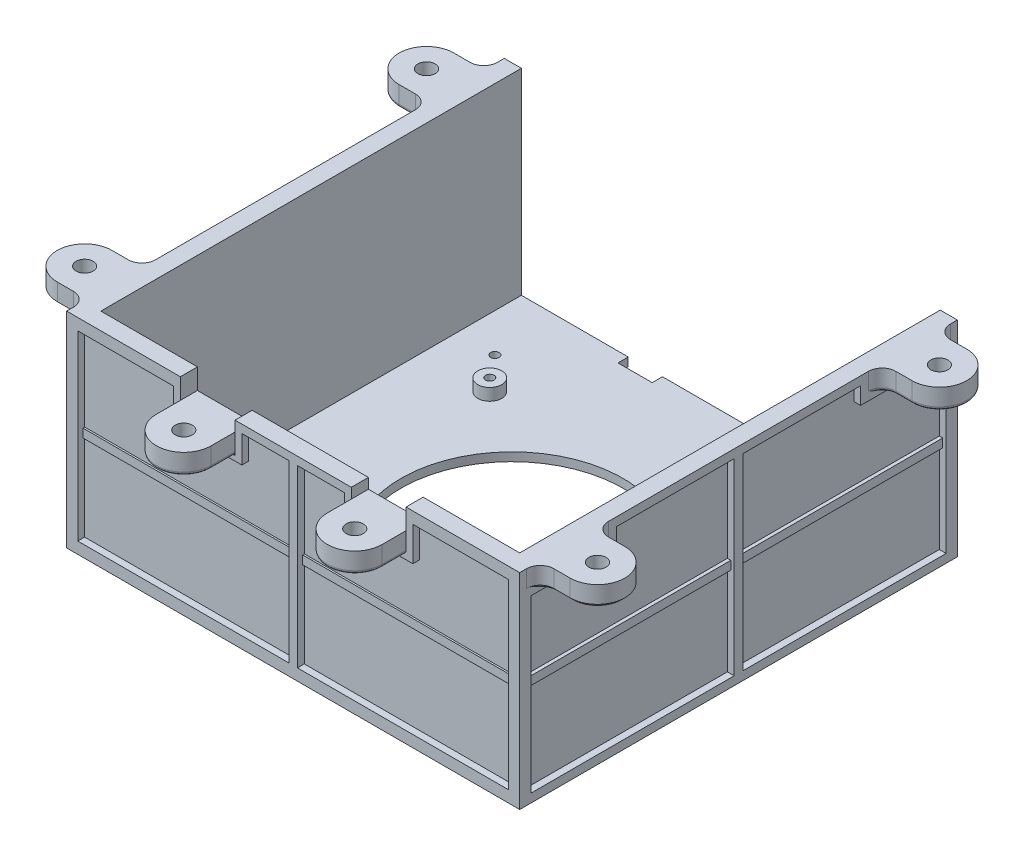
from build123d import *
from build123d.topology import SkipClean

# Parameters (mm, degrees)
SKETCH_1_W                  = 122.5
SKETCH_1_H                  = 128
SKETCH_1_R                  = 32.5
EXTRUDE_2_DEPTH             = 2.5
SKETCH_25_W                 = 5
SKETCH_25_H                 = 60
EXTRUDE_3_DEPTH             = 128
EXTRUDE_4_DEPTH             = 6
HOLE_WIZARD_M6_1_D          = 5
HOLE_WIZARD_M6_1_DEPTH      = 60
FILLET_3435_R               = 4
CHAMFER_5_SIZE              = 1
CUT_EXTRUDE_2_DEPTH         = 2
RIB_START                   = -1.25
RIB_21_OUTLINE_W            = 2
RIB_21_OUTLINE_H            = 55
RIB_21_DEPTH                = 2.5
RIB_19_OUTLINE_W            = 1
RIB_19_OUTLINE_H            = 59.462932812
RIB_19_DEPTH                = 2.5
MIRROR_START                = -1.25
MIRROR_24_COPY_1_SKETCH_W   = 1
MIRROR_24_COPY_1_SKETCH_H   = 59.462932812
MIRROR_24_COPY_1_DEPTH      = 2.5
SKETCH_75_R                 = 3.5
ADAPTER1_DEPTH              = 6
SKETCH_106_W                = 1.25
SKETCH_106_H                = 2.5
HOLE_WIZARD_M3_1_AT_2_COUNT = 2
HOLE_WIZARD_M3_1_AT_2_PITCH = 13.124404748
HOLE_WIZARD_M3_2_D          = 2.5
MIRROR_26_COPY_1_SKETCH_W   = 1.25
MIRROR_26_COPY_1_SKETCH_H   = 2.5
MIRROR_26_COPY_2_D          = 2.5
MIRROR_26_COPY_3_D          = 2.5
FILLET_7_R                  = 4
MIRROR_30_COPY_1_D          = 5
MIRROR_30_COPY_1_DEPTH      = 60
MIRROR_30_COPY_2_D          = 5
MIRROR_30_COPY_2_DEPTH      = 60
SKETCH_112_W                = 122.5
SKETCH_112_H                = 5
EXTRUDE_5_DEPTH             = 57.5
CUT_EXTRUDE_6_DEPTH         = 2
RIB_30_OUTLINE_W            = 2
RIB_30_OUTLINE_H            = 51.25
RIB_30_DEPTH                = 2.5
RIB_35_OUTLINE_W            = 61.75
RIB_35_OUTLINE_H            = 0.5
RIB_35_DEPTH                = 2.5
SKETCH_131_W                = 16
SKETCH_131_H                = 5
CUT_EXTRUDE_7_DEPTH         = 182.946592439
EXTRUDE_8_DEPTH             = 6
SKETCH_134_W                = 2.5
SKETCH_134_H                = 54
MIRROR_START_2              = 54
MIRROR_40_OUTLINE_W         = 16
MIRROR_40_OUTLINE_H         = 5
MIRROR_40_DEPTH             = 6
MIRROR_START_3              = 48
MIRROR_40_2_OUTLINE_R       = 2.5
MIRROR_40_2_DEPTH           = 6
FILLET_10_R                 = 1
FILLET_11_R                 = 1
EXTRUDE_9_DEPTH             = 3
SKETCH_138_W                = 1.65
SKETCH_138_H                = 140
FILLET_13_R                 = 1
SKETCH_139_W                = 10
SKETCH_139_H                = 2.5
CUT_EXTRUDE_8_DEPTH         = 3
SKETCH_140_W                = 34
SKETCH_140_H                = 5
CUT_EXTRUDE_9_DEPTH         = 3
FILLET_15_R                 = 1
MIRROR_START_4              = -1
MIRROR_48_OUTLINE_R         = 1.25
MIRROR_48_DEPTH             = 4
MIRROR_49_OUTLINE_R         = 1.25
MIRROR_49_DEPTH             = 4


with BuildPart() as part:
    # 草图1 → 凸台-拉伸2 (new body)
    with BuildSketch(Plane(origin=(0, 0, 0), x_dir=(1, 0, 0), z_dir=(0, 1, 0))):
        with Locations((53.75, 46)):
            Rectangle(SKETCH_1_W, SKETCH_1_H)
        with Locations(Location((53.75, 46, 0), (0, 0, 270))):
            Circle(SKETCH_1_R, mode=Mode.SUBTRACT)
    extrude(amount=EXTRUDE_2_DEPTH)

    # 草图25 → 凸台-拉伸3 (add)
    with BuildSketch(Plane.XY.offset(18)):
        with Locations((-10, 30)):
            Rectangle(SKETCH_25_W, SKETCH_25_H)
        with Locations((117.5, 30)):
            Rectangle(SKETCH_25_W, SKETCH_25_H)
    extrude(amount=-EXTRUDE_3_DEPTH)

    # 草图67 → 凸台-拉伸4 (add)
    with BuildSketch(Plane(origin=(0, 60, 0), x_dir=(1, 0, 0), z_dir=(0, 1, 0))):
        with BuildLine():
            Line((120, -12), (128.75, -12))
            ThreePointArc((128.75, -12), (136.75, -4), (128.75, 4))
            Line((128.75, 4), (120, 4))
            Line((120, 4), (120, -12))
        make_face()
        with BuildLine():
            Line((120, 104), (120, 88))
            Line((120, 88), (128.75, 88))
            ThreePointArc((128.75, 88), (136.75, 96), (128.75, 104))
            Line((128.75, 104), (120, 104))
        make_face()
    extrude_4 = extrude(amount=-EXTRUDE_4_DEPTH)

    # M6 螺纹孔1
    with Locations(Plane(origin=(0, 60, 0), x_dir=(1, 0, 0), z_dir=(0, 1, 0))):
        with Locations((128.75, -4)):
            hole_wizard_m6_1 = Hole(HOLE_WIZARD_M6_1_D / 2, depth=HOLE_WIZARD_M6_1_DEPTH)

    # 镜向15: 凸台-拉伸4, M6 螺纹孔1 across plane
    add(extrude_4.mirror(Plane.ZY.offset(-53.75)))
    add(hole_wizard_m6_1.mirror(Plane.ZY.offset(-53.75)), mode=Mode.SUBTRACT)

    # Fillet 3435
    fillet_3435_edges = [part.edges().sort_by_distance(p)[0] for p in [
        (120, 57, 12),
        (120, 57, -4),
        (-12.5, 57, -4),
        (-12.5, 57, 12),
    ]]
    fillet(fillet_3435_edges, radius=FILLET_3435_R)

    # Chamfer 5
    # the kernel refuses this chamfer: 1 mm, written as the material it takes off along each edge
    with BuildSketch(Plane(origin=(-16.5, 54, 12), x_dir=(0, 1, 0), z_dir=(-1, 0, 0)), Plane(origin=(-21.25, 54, -4), x_dir=(0, 1, 0), z_dir=(1, 0, 0))) as chamfer_5_piece_1:
        Polygon((CHAMFER_5_SIZE, 0), (0, CHAMFER_5_SIZE), (0, 0), align=None)
    extrude(amount=4.75, mode=Mode.SUBTRACT)
    with BuildSketch(Plane(origin=(124, 54, 12), x_dir=(0, 1, 0), z_dir=(1, 0, 0)), Plane(origin=(128.75, 54, -4), x_dir=(0, 1, 0), z_dir=(-1, 0, 0))) as chamfer_5_piece_2:
        Polygon((CHAMFER_5_SIZE, 0), (0, -CHAMFER_5_SIZE), (0, 0), align=None)
    extrude(amount=4.75, mode=Mode.SUBTRACT)
    with BuildSketch(Plane(origin=(-16.5, 54, -8), x_dir=(0.4594643283899522, 0, -0.8881962232171281), z_dir=(-0.8881962232171281, 0, -0.4594643283899522))) as chamfer_5_piece_3_section:
        Polygon((4, -CHAMFER_5_SIZE), (4 + CHAMFER_5_SIZE, 0), (4, 0), align=None)
    chamfer_5_piece_3 = revolve(axis=Axis((-16.5, 54, -8), (0, -1, 0)), revolution_arc=152.647453006, mode=Mode.PRIVATE)
    chamfer_5_piece_3 = split(chamfer_5_piece_3, bisect_by=Plane(origin=(-12.5, 54, -8), z_dir=(-1, 0, 0)), keep=Keep.TOP, mode=Mode.PRIVATE)
    add(chamfer_5_piece_3, mode=Mode.SUBTRACT)
    with BuildSketch(Plane(origin=(-16.5, 54, 16), x_dir=(0.45946432838995255, 0, 0.8881962232171279), z_dir=(-0.8881962232171279, 0, 0.45946432838995255))) as chamfer_5_piece_4_section:
        Polygon((4 + CHAMFER_5_SIZE, 0), (4, CHAMFER_5_SIZE), (4, 0), align=None)
    chamfer_5_piece_4 = revolve(axis=Axis((-16.5, 54, 16), (0, 1, 0)), revolution_arc=152.647453006, mode=Mode.PRIVATE)
    chamfer_5_piece_4 = split(chamfer_5_piece_4, bisect_by=Plane(origin=(-12.5, 54, 16), z_dir=(-1, 0, 0)), keep=Keep.TOP, mode=Mode.PRIVATE)
    add(chamfer_5_piece_4, mode=Mode.SUBTRACT)
    with BuildSketch(Plane(origin=(124, 54, 16), x_dir=(-0.4594643283899522, 0, 0.8881962232171281), z_dir=(0.8881962232171281, 0, 0.4594643283899522))) as chamfer_5_piece_5_section:
        Polygon((4, -CHAMFER_5_SIZE), (4 + CHAMFER_5_SIZE, 0), (4, 0), align=None)
    chamfer_5_piece_5 = revolve(axis=Axis((124, 54, 16), (0, -1, 0)), revolution_arc=152.647453006, mode=Mode.PRIVATE)
    chamfer_5_piece_5 = split(chamfer_5_piece_5, bisect_by=Plane(origin=(120, 54, 16), z_dir=(1, 0, 0)), keep=Keep.TOP, mode=Mode.PRIVATE)
    add(chamfer_5_piece_5, mode=Mode.SUBTRACT)
    with BuildSketch(Plane(origin=(124, 54, -8), x_dir=(-0.4594643283899523, 0, -0.8881962232171279), z_dir=(0.8881962232171279, 0, -0.4594643283899523))) as chamfer_5_piece_6_section:
        Polygon((4 + CHAMFER_5_SIZE, 0), (4, CHAMFER_5_SIZE), (4, 0), align=None)
    chamfer_5_piece_6 = revolve(axis=Axis((124, 54, -8), (0, 1, 0)), revolution_arc=152.647453006, mode=Mode.PRIVATE)
    chamfer_5_piece_6 = split(chamfer_5_piece_6, bisect_by=Plane(origin=(120, 54, -8), z_dir=(1, 0, 0)), keep=Keep.TOP, mode=Mode.PRIVATE)
    add(chamfer_5_piece_6, mode=Mode.SUBTRACT)
    with BuildSketch(Plane(origin=(128.75, 54, 4), x_dir=(0, 0, 1), z_dir=(-1, 0, 0))) as chamfer_5_piece_7:
        Polygon((8, CHAMFER_5_SIZE), (8 - CHAMFER_5_SIZE, 0), (8, 0), align=None)
    revolve(axis=Axis((128.75, 54, 4), (0, 1, 0)), revolution_arc=180, mode=Mode.SUBTRACT)
    with BuildSketch(Plane(origin=(-21.25, 54, 4), x_dir=(0, 0, 1), z_dir=(1, 0, 0))) as chamfer_5_piece_8:
        Polygon((8, -CHAMFER_5_SIZE), (8 - CHAMFER_5_SIZE, 0), (8, 0), align=None)
    revolve(axis=Axis((-21.25, 54, 4), (0, -1, 0)), revolution_arc=180, mode=Mode.SUBTRACT)

    # 草图79 → 切除-拉伸2 (cut)
    with BuildSketch(Plane(origin=(120, 0, 0), x_dir=(0, 0, -1), z_dir=(1, 0, 0))):
        Polygon((106.712932812, 2.5), (-14.712932812, 2.5), (-14.712932812, 52.5), (10.287067188, 52.5), (10.287067188, 57.5), (81.712932812, 57.5), (81.712932812, 52.5), (106.712932812, 52.5), align=None)
    cut_extrude_2 = extrude(amount=-CUT_EXTRUDE_2_DEPTH, mode=Mode.SUBTRACT)

    # 筋21: read off the stored shape, not the designer's step
    # 筋21 outline → 筋21 (add)
    with BuildSketch(Plane.XY.offset(-46).offset(RIB_START)):
        with Locations((119, 30)):
            Rectangle(RIB_21_OUTLINE_W, RIB_21_OUTLINE_H)
    rib_21 = extrude(amount=RIB_21_DEPTH)

    # 筋19: read off the stored shape, not the designer's step
    # 筋19 outline → 筋19 (add)
    with BuildSketch(Plane(origin=(0, 30, 0), x_dir=(1, 0, 0), z_dir=(0, 1, 0)).offset(RIB_START)):
        with Locations((118.5, 15.018533594)):
            Rectangle(RIB_19_OUTLINE_W, RIB_19_OUTLINE_H)
    rib_19 = extrude(amount=RIB_19_DEPTH)

    # 镜向23: 筋19 across plane
    add(rib_19.mirror(Plane.XY.offset(-46)))

    # 镜向24: 切除-拉伸2, 筋21, 筋19 across plane
    add(cut_extrude_2.mirror(Plane.ZY.offset(-53.75)), mode=Mode.SUBTRACT)
    add(rib_21.mirror(Plane.ZY.offset(-53.75)))
    add(rib_19.mirror(Plane.ZY.offset(-53.75)))

    # 镜向24 copy 1 sketch → 镜向24 copy 1 (add)
    with BuildSketch(Plane(origin=(107.5, 30, -92), x_dir=(-1, 0, 0), z_dir=(0, 1, 0)).offset(MIRROR_START)):
        with Locations((118.5, 15.018533594)):
            Rectangle(MIRROR_24_COPY_1_SKETCH_W, MIRROR_24_COPY_1_SKETCH_H)
    extrude(amount=MIRROR_24_COPY_1_DEPTH)

    # 草图75 → 定位adapter1 (add)
    with BuildSketch(Plane(origin=(0, 0, 0), x_dir=(-1, 0, 0), z_dir=(0, -1, 0))):
        with Locations(Location((-12.25, 81, 0), (0, 0, 90))):
            Circle(SKETCH_75_R)
        with Locations(Location((-95.25, 81, 0), (0, 0, 90))):
            Circle(SKETCH_75_R)
        with Locations(Location((-95.25, 11, 0), (0, 0, 90))):
            Circle(SKETCH_75_R)
        with Locations(Location((-12.25, 11, 0), (0, 0, 90))):
            Circle(SKETCH_75_R)
    extrude(amount=-ADAPTER1_DEPTH)

    # 草图106 → M3 螺纹孔1 (revolve, cut)
    with BuildSketch(Plane(origin=(12.25, 2.5, -81), x_dir=(0, 0, 1), z_dir=(1, 0, 0))):
        with Locations((0.625, 1.25)):
            Rectangle(SKETCH_106_W, SKETCH_106_H)
    hole_wizard_m3_1 = revolve(axis=Axis((12.25, 8.85, -81), (0, -1, 0)), mode=Mode.SUBTRACT)

    # M3 螺纹孔1 at 2: M3 螺纹孔1 ×2
    with Locations(*[Vector(-0.6476484200955406, 0, -0.7619393177594592) * (i * HOLE_WIZARD_M3_1_AT_2_PITCH) for i in range(1, HOLE_WIZARD_M3_1_AT_2_COUNT)]):
        add(hole_wizard_m3_1, mode=Mode.SUBTRACT)

    # M3 螺纹孔2 (through all)
    with Locations(Plane(origin=(0, 6, 0), x_dir=(1, 0, 0), z_dir=(0, 1, 0))):
        with Locations((12.25, 81)):
            hole_wizard_m3_2 = Hole(HOLE_WIZARD_M3_2_D / 2)

    # 镜向25: M3 螺纹孔2 across plane
    with SkipClean():  # the faces are left unmerged after this step: merging them gives an invalid solid
        add(hole_wizard_m3_2.mirror(Plane.ZY.offset(-53.75)), mode=Mode.SUBTRACT)

    # 镜向26: M3 螺纹孔1 across plane
    with SkipClean():  # the faces are left unmerged after this step: merging them gives an invalid solid
        add(hole_wizard_m3_1.mirror(Plane.XY.offset(-46)), mode=Mode.SUBTRACT)

    # 镜向26 copy 1 sketch → 镜向26 copy 1 (revolve, cut)
    with SkipClean():  # the faces are left unmerged after this step: merging them gives an invalid solid
        with BuildSketch(Plane(origin=(3.75, 2.5, -1), x_dir=(0, 0, -1), z_dir=(1, 0, 0))):
            with Locations((0.625, -1.25)):
                Rectangle(MIRROR_26_COPY_1_SKETCH_W, MIRROR_26_COPY_1_SKETCH_H)
        revolve(axis=Axis((3.75, 8.85, -1), (0, 1, 0)), mode=Mode.SUBTRACT)

    # 镜向26 copy 2 (through all)
    with Locations(Plane(origin=(107.5, 6, -92), x_dir=(-1, 0, 0), z_dir=(0, 1, 0))):
        with Locations((12.25, 81)):
            Hole(MIRROR_26_COPY_2_D / 2)

    # 镜向26 copy 3 (through all)
    with Locations(Plane(origin=(0, 6, -92), x_dir=(1, 0, 0), z_dir=(0, 1, 0))):
        with Locations((12.25, -81)):
            Hole(MIRROR_26_COPY_3_D / 2)

    # 镜向27: M6 螺纹孔1 across plane
    with SkipClean():  # the faces are left unmerged after this step: merging them gives an invalid solid
        add(hole_wizard_m6_1.mirror(Plane.XY.offset(-46)), mode=Mode.SUBTRACT)

    # 圆角7
    fillet_7_edges = [part.edges().sort_by_distance(p)[0] for p in [
        (120, 57, -104),
        (120, 57, -88),
        (-12.5, 57, -104),
        (-12.5, 57, -88),
    ]]
    fillet(fillet_7_edges, radius=FILLET_7_R)

    # 镜向30 copy 1
    with Locations(Plane(origin=(107.5, 60, -92), x_dir=(-1, 0, 0), z_dir=(0, 1, 0))):
        with Locations((128.75, -4)):
            Hole(MIRROR_30_COPY_1_D / 2, depth=MIRROR_30_COPY_1_DEPTH)

    # 镜向30 copy 2
    with Locations(Plane(origin=(107.5, 60, 0), x_dir=(-1, 0, 0), z_dir=(0, 1, 0))):
        with Locations((128.75, 4)):
            Hole(MIRROR_30_COPY_2_D / 2, depth=MIRROR_30_COPY_2_DEPTH)

    # 草图112 → 凸台-拉伸5 (add)
    with SkipClean():  # the faces are left unmerged after this step: merging them gives an invalid solid
        with BuildSketch(Plane(origin=(0, 2.5, 0), x_dir=(1, 0, 0), z_dir=(0, 1, 0))):
            with Locations((53.75, -15.5)):
                Rectangle(SKETCH_112_W, SKETCH_112_H)
        extrude(amount=EXTRUDE_5_DEPTH)

    # 草图124 → 切除-拉伸6 (cut)
    with SkipClean():  # the faces are left unmerged after this step: merging them gives an invalid solid
        with BuildSketch(Plane.XY.offset(18)):
            Polygon((116.75, 56.625), (88.75, 56.625), (88.75, 46.625), (68.75, 46.625), (68.75, 54.625), (38.75, 54.625), (38.75, 46.625), (18.75, 46.625), (18.75, 56.625), (-9.25, 56.625), (-9.25, 3.375), (116.75, 3.375), align=None)
        extrude(amount=-CUT_EXTRUDE_6_DEPTH, mode=Mode.SUBTRACT)

    # 筋30: read off the stored shape, not the designer's step
    # 筋30 outline → 筋30 (add)
    with SkipClean():  # the faces are left unmerged after this step: merging them gives an invalid solid
        with BuildSketch(Plane.ZY.offset(-53.75).offset(RIB_START)):
            with Locations((17, 29)):
                Rectangle(RIB_30_OUTLINE_W, RIB_30_OUTLINE_H)
        extrude(amount=RIB_30_DEPTH)

    # 筋35: read off the stored shape, not the designer's step
    # 筋35 outline → 筋35 (add)
    with SkipClean():  # the faces are left unmerged after this step: merging them gives an invalid solid
        with BuildSketch(Plane(origin=(0, 30, 0), x_dir=(1, 0, 0), z_dir=(0, 1, 0)).offset(RIB_START)):
            with Locations((21.625, -16.25)):
                Rectangle(RIB_35_OUTLINE_W, RIB_35_OUTLINE_H)
        rib_35 = extrude(amount=RIB_35_DEPTH)

    # 镜向35: 筋35 across plane
    with SkipClean():  # the faces are left unmerged after this step: merging them gives an invalid solid
        add(rib_35.mirror(Plane.ZY.offset(-53.75)))

    # 草图131 → 切除-拉伸7 (cut, through all)
    with SkipClean():  # the faces are left unmerged after this step: merging them gives an invalid solid
        with BuildSketch(Plane(origin=(0, 48, 0), x_dir=(1, 0, 0), z_dir=(0, 1, 0))):
            with Locations((28.75, -15.5)):
                Rectangle(SKETCH_131_W, SKETCH_131_H)
        extrude(amount=CUT_EXTRUDE_7_DEPTH, mode=Mode.SUBTRACT)

    # 镜向40: read off the stored shape, not the designer's step
    # 镜向40 outline → 镜向40 (cut)
    with SkipClean():  # the faces are left unmerged after this step: merging them gives an invalid solid
        with BuildSketch(Plane(origin=(0, 0, 0), x_dir=(1, 0, 0), z_dir=(0, 1, 0)).offset(MIRROR_START_2)):
            with Locations((78.75, -15.5)):
                Rectangle(MIRROR_40_OUTLINE_W, MIRROR_40_OUTLINE_H)
        extrude(amount=MIRROR_40_DEPTH, mode=Mode.SUBTRACT)

    # Mirror 40 2 outline → Mirror 40 2 (add)
    with SkipClean():  # the faces are left unmerged after this step: merging them gives an invalid solid
        with BuildSketch(Plane(origin=(0, 0, 0), x_dir=(1, 0, 0), z_dir=(0, 1, 0)).offset(MIRROR_START_3)):
            with BuildLine():
                Line((86.75, -25), (86.75, -18))
                Line((86.75, -18), (70.75, -18))
                Line((70.75, -18), (70.75, -25))
                ThreePointArc((70.75, -25), (78.75, -33), (86.75, -25))
            make_face()
            with Locations((78.75, -25)):
                Circle(MIRROR_40_2_OUTLINE_R, mode=Mode.SUBTRACT)
        extrude(amount=MIRROR_40_2_DEPTH)

    # 圆角11
    fillet_11_edges = [part.edges().sort_by_distance(p)[0] for p in [
        (70.75, 48, 21.5),
        (86.75, 48, 21.5),
        (78.75, 48, 33),
    ]]
    fillet(fillet_11_edges, radius=FILLET_11_R)

    # 草图135 → 凸台-拉伸9 (add)
    with SkipClean():  # the faces are left unmerged after this step: merging them gives an invalid solid
        with BuildSketch(Plane(origin=(0, 0, -104), x_dir=(-1, 0, 0), z_dir=(0, 0, -1))):
            with BuildLine():
                Line((-83.75, 2.5), (-73.75, 2.5))
                Line((-73.75, 2.5), (-73.75, -5.5))
                ThreePointArc((-73.75, -5.5), (-78.75, -10.5), (-83.75, -5.5))
                Line((-83.75, -5.5), (-83.75, 2.5))
            make_face()
            with BuildLine():
                Line((-33.75, 2.5), (-33.75, -5.5))
                ThreePointArc((-33.75, -5.5), (-28.75, -10.5), (-23.75, -5.5))
                Line((-23.75, -5.5), (-23.75, 2.5))
                Line((-23.75, 2.5), (-33.75, 2.5))
            make_face()
        extrude(amount=EXTRUDE_9_DEPTH)

    # 草图138 → M4 螺纹孔11 (revolve, cut)
    with SkipClean():  # the faces are left unmerged after this step: merging them gives an invalid solid
        with BuildSketch(Plane(origin=(78.75, -5.5, -107), x_dir=(0, 1, 0), z_dir=(1, 0, 0))):
            with Locations((0.825, 70)):
                Rectangle(SKETCH_138_W, SKETCH_138_H)
        hole_wizard_m4_11 = revolve(axis=Axis((78.75, -5.5, -113.35), (0, 0, 1)), mode=Mode.SUBTRACT)

    # 镜向46: M4 螺纹孔11 across plane
    with SkipClean():  # the faces are left unmerged after this step: merging them gives an invalid solid
        add(hole_wizard_m4_11.mirror(Plane.ZY.offset(-53.75)), mode=Mode.SUBTRACT)

    # 圆角13
    fillet_13_edges = [part.edges().sort_by_distance(p)[0] for p in [
        (83.75, -2.75, -104),
        (78.75, -10.5, -104),
        (73.75, -2.75, -104),
        (33.75, -2.75, -104),
        (28.75, -10.5, -104),
        (23.75, -2.75, -104),
    ]]
    fillet(fillet_13_edges, radius=FILLET_13_R)

    # 草图139 → 切除-拉伸8 (cut)
    with SkipClean():  # the faces are left unmerged after this step: merging them gives an invalid solid
        with BuildSketch(Plane(origin=(0, 0, -110), x_dir=(-1, 0, 0), z_dir=(0, 0, -1))):
            with Locations((-78.75, 1.25)):
                Rectangle(SKETCH_139_W, SKETCH_139_H)
        cut_extrude_8 = extrude(amount=-CUT_EXTRUDE_8_DEPTH, mode=Mode.SUBTRACT)

    # 镜向47: 切除-拉伸8 across plane
    with SkipClean():  # the faces are left unmerged after this step: merging them gives an invalid solid
        add(cut_extrude_8.mirror(Plane.ZY.offset(-53.75)), mode=Mode.SUBTRACT)

    # 草图140 → 切除-拉伸9 (cut)
    with SkipClean():  # the faces are left unmerged after this step: merging them gives an invalid solid
        with BuildSketch(Plane(origin=(0, 60, 0), x_dir=(1, 0, 0), z_dir=(0, 1, 0))):
            with Locations((53.75, -15.5)):
                Rectangle(SKETCH_140_W, SKETCH_140_H)
        extrude(amount=-CUT_EXTRUDE_9_DEPTH, mode=Mode.SUBTRACT)

    # 圆角15
    # the kernel refuses this fillet: 1 mm, written as the material it takes off along each edge
    with BuildSketch(Plane(origin=(128.75, 54, -104), x_dir=(0, 0, 1), z_dir=(-1, 0, 0)), Plane(origin=(124, 54, -88), x_dir=(0, 0, -1), z_dir=(1, 0, 0))) as fillet_15_piece_1:
        with BuildLine():
            CenterArc((FILLET_15_R, FILLET_15_R), FILLET_15_R, 180, 90)
            Line((0, FILLET_15_R), (0, 0))
            Line((0, 0), (FILLET_15_R, 0))
        make_face()
    extrude(amount=4.75, mode=Mode.SUBTRACT)
    with BuildSketch(Plane(origin=(128.75, 54, -96), x_dir=(0, 0, 1), z_dir=(-1, 0, 0))) as fillet_15_piece_2:
        with BuildLine():
            CenterArc((8 - FILLET_15_R, FILLET_15_R), FILLET_15_R, 270, 90)
            Line((8, FILLET_15_R), (8, 0))
            Line((8, 0), (8 - FILLET_15_R, 0))
        make_face()
    revolve(axis=Axis((128.75, 54, -96), (0, 1, 0)), revolution_arc=180, mode=Mode.SUBTRACT)
    with BuildSketch(Plane(origin=(-16.5, 54, -88), x_dir=(0, 0, -1), z_dir=(-1, 0, 0)), Plane(origin=(-21.25, 54, -104), x_dir=(0, 0, 1), z_dir=(1, 0, 0))) as fillet_15_piece_3:
        with BuildLine():
            CenterArc((FILLET_15_R, -FILLET_15_R), FILLET_15_R, 90, 90)
            Line((0, -FILLET_15_R), (0, 0))
            Line((0, 0), (FILLET_15_R, 0))
        make_face()
    extrude(amount=4.75, mode=Mode.SUBTRACT)
    with BuildSketch(Plane(origin=(-16.5, 54, -84), x_dir=(0.48631676857152195, 0, 0.8737825819997518), z_dir=(-0.8737825819997518, 0, 0.48631676857152195))) as fillet_15_piece_4_section:
        with BuildLine():
            CenterArc((4 + FILLET_15_R, FILLET_15_R), FILLET_15_R, 180, 90)
            Line((4 + FILLET_15_R, 0), (4, 0))
            Line((4, 0), (4, FILLET_15_R))
        make_face()
    fillet_15_piece_4 = revolve(axis=Axis((-16.5, 54, -84), (0, 1, 0)), revolution_arc=150.901220426, mode=Mode.PRIVATE)
    fillet_15_piece_4 = split(fillet_15_piece_4, bisect_by=Plane(origin=(-12.5, 54, -84), z_dir=(-1, 0, 0)), keep=Keep.TOP, mode=Mode.PRIVATE)
    add(fillet_15_piece_4, mode=Mode.SUBTRACT)
    with BuildSketch(Plane(origin=(-16.5, 54, -108), x_dir=(0.48631676857152156, 0, -0.8737825819997519), z_dir=(-0.8737825819997519, 0, -0.48631676857152156))) as fillet_15_piece_5_section:
        with BuildLine():
            CenterArc((4 + FILLET_15_R, -FILLET_15_R), FILLET_15_R, 90, 90)
            Line((4, -FILLET_15_R), (4, 0))
            Line((4, 0), (4 + FILLET_15_R, 0))
        make_face()
    fillet_15_piece_5 = revolve(axis=Axis((-16.5, 54, -108), (0, -1, 0)), revolution_arc=150.901220426, mode=Mode.PRIVATE)
    fillet_15_piece_5 = split(fillet_15_piece_5, bisect_by=Plane(origin=(-12.5, 54, -108), z_dir=(-1, 0, 0)), keep=Keep.TOP, mode=Mode.PRIVATE)
    add(fillet_15_piece_5, mode=Mode.SUBTRACT)
    with BuildSketch(Plane(origin=(124, 54, -84), x_dir=(-0.48631676857151596, 0, 0.873782581999755), z_dir=(0.873782581999755, 0, 0.48631676857151596))) as fillet_15_piece_6_section:
        with BuildLine():
            CenterArc((4 + FILLET_15_R, -FILLET_15_R), FILLET_15_R, 90, 90)
            Line((4, -FILLET_15_R), (4, 0))
            Line((4, 0), (4 + FILLET_15_R, 0))
        make_face()
    fillet_15_piece_6 = revolve(axis=Axis((124, 54, -84), (0, -1, 0)), revolution_arc=150.901220426, mode=Mode.PRIVATE)
    fillet_15_piece_6 = split(fillet_15_piece_6, bisect_by=Plane(origin=(120, 54, -84), z_dir=(1, 0, 0)), keep=Keep.TOP, mode=Mode.PRIVATE)
    add(fillet_15_piece_6, mode=Mode.SUBTRACT)
    with BuildSketch(Plane(origin=(124, 54, -108), x_dir=(-0.48631676857151596, 0, -0.873782581999755), z_dir=(0.873782581999755, 0, -0.48631676857151596))) as fillet_15_piece_7_section:
        with BuildLine():
            CenterArc((4 + FILLET_15_R, FILLET_15_R), FILLET_15_R, 180, 90)
            Line((4 + FILLET_15_R, 0), (4, 0))
            Line((4, 0), (4, FILLET_15_R))
        make_face()
    fillet_15_piece_7 = revolve(axis=Axis((124, 54, -108), (0, 1, 0)), revolution_arc=150.901220426, mode=Mode.PRIVATE)
    fillet_15_piece_7 = split(fillet_15_piece_7, bisect_by=Plane(origin=(120, 54, -108), z_dir=(1, 0, 0)), keep=Keep.TOP, mode=Mode.PRIVATE)
    add(fillet_15_piece_7, mode=Mode.SUBTRACT)
    with BuildSketch(Plane(origin=(-21.25, 54, -96), x_dir=(0, 0, 1), z_dir=(1, 0, 0))) as fillet_15_piece_8:
        with BuildLine():
            CenterArc((8 - FILLET_15_R, -FILLET_15_R), FILLET_15_R, 0, 90)
            Line((8, -FILLET_15_R), (8, 0))
            Line((8, 0), (8 - FILLET_15_R, 0))
        make_face()
    revolve(axis=Axis((-21.25, 54, -96), (0, -1, 0)), revolution_arc=180, mode=Mode.SUBTRACT)

    # 镜向48: read off the stored shape, not the designer's step
    # 镜向48 outline → 镜向48 (cut)
    with BuildSketch(Plane(origin=(0, 0, 0), x_dir=(1, 0, 0), z_dir=(0, 1, 0)).offset(MIRROR_START_4)):
        with Locations((103.75, 91)):
            Circle(MIRROR_48_OUTLINE_R)
    extrude(amount=MIRROR_48_DEPTH, mode=Mode.SUBTRACT)

    # 镜向49: read off the stored shape, not the designer's step
    # 镜向49 outline → 镜向49 (cut)
    with BuildSketch(Plane(origin=(0, 0, 0), x_dir=(1, 0, 0), z_dir=(0, 1, 0)).offset(MIRROR_START_4)):
        with Locations((103.75, 1)):
            Circle(MIRROR_49_OUTLINE_R)
    extrude(amount=MIRROR_49_DEPTH, mode=Mode.SUBTRACT)


with BuildPart() as body_2:
    # 草图132 → 凸台-拉伸8 (new body)
    with BuildSketch(Plane(origin=(0, 48, 0), x_dir=(1, 0, 0), z_dir=(0, 1, 0))):
        with BuildLine():
            Line((20.75, -13), (36.75, -13))
            Line((36.75, -13), (36.75, -25))
            ThreePointArc((36.75, -25), (28.75, -33), (20.75, -25))
            Line((20.75, -25), (20.75, -13))
        make_face()
    extrude(amount=EXTRUDE_8_DEPTH)

    # 草图134 → M6 螺纹孔2 (revolve, cut)
    with BuildSketch(Plane(origin=(28.75, 54, 25), x_dir=(0, 0, 1), z_dir=(1, 0, 0))):
        with Locations((1.25, 27)):
            Rectangle(SKETCH_134_W, SKETCH_134_H)
    revolve(axis=Axis((28.75, 60.35, 25), (0, -1, 0)), mode=Mode.SUBTRACT)

    # 圆角10
    fillet_10_edges = [body_2.edges().sort_by_distance(p)[0] for p in [
        (36.75, 48, 19),
        (28.75, 48, 33),
        (20.75, 48, 19),
    ]]
    fillet(fillet_10_edges, radius=FILLET_10_R)


solid = Compound([part.part, body_2.part])
